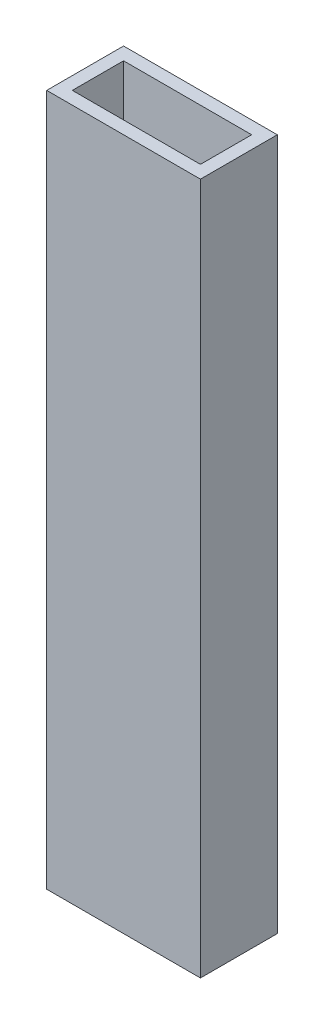
from build123d import *

# Parameters (mm, degrees)
SKETCH1_W           = 38.1
SKETCH1_H           = 19.05
SKETCH1_W_2         = 31.75
SKETCH1_H_2         = 12.7
BOSS_EXTRUDE1_DEPTH = 171.45


with BuildPart() as part:
    # Sketch1 → Boss-Extrude1 (new body)
    with BuildSketch(Plane(origin=(0, 0, 0), x_dir=(1, 0, 0), z_dir=(0, 1, 0))):
        with Locations((19.05, 9.525)):
            Rectangle(SKETCH1_W, SKETCH1_H)
        with Locations((19.05, 9.525)):
            Rectangle(SKETCH1_W_2, SKETCH1_H_2, mode=Mode.SUBTRACT)
    extrude(amount=BOSS_EXTRUDE1_DEPTH)


solid = part.part
